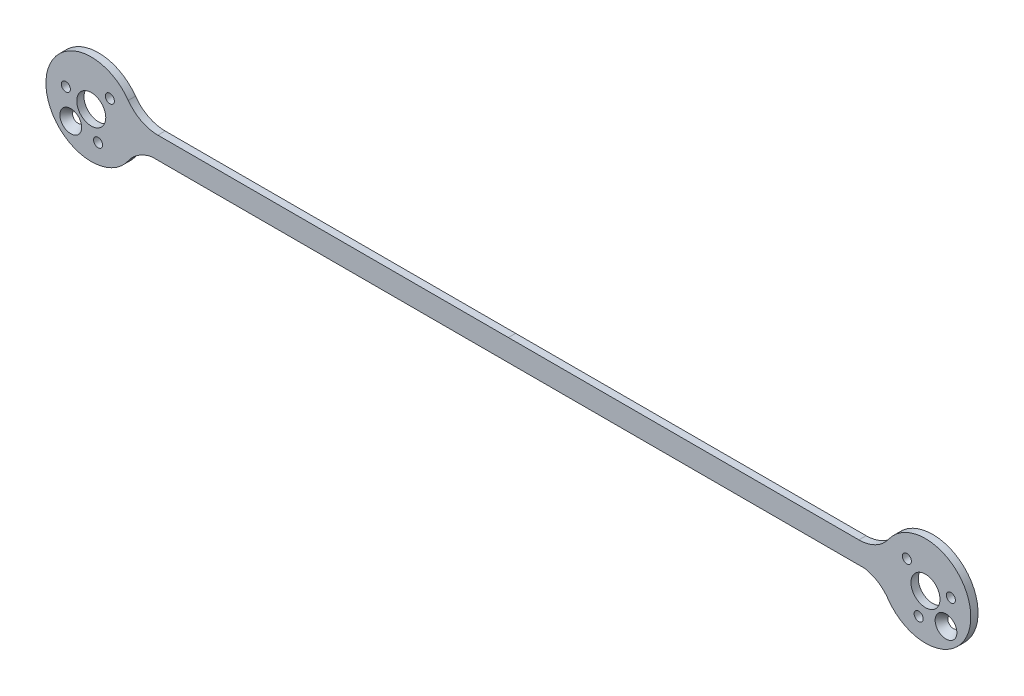
from build123d import *
from OCP.BRepFilletAPI import BRepFilletAPI_MakeChamfer

# Parameters (mm, degrees)
SKETCH_1_R       = 3
SKETCH_1_R_2     = 4
SKETCH_1_R_3     = 1.25
SKETCH_1_R_4     = 1.5
EXTRUDE_1_DEPTH  = 2
CHAMFER_1_SIZE   = 1.5
CHAMFER_1_SIZE_2 = 2


with BuildPart() as part:
    # 草图1 → 凸台-拉伸1 (new body)
    # profile 1 of 3: a face of its own
    with BuildSketch(Plane.XY):
        with BuildLine():
            ThreePointArc((-105.718905787, 7.244728588), (-102.151651286, 4.140596435), (-97.556989056, 3.022553461))
            Line((-97.556989056, 3.022553461), (-0.921282848, 3.022639283))
            Line((-0.921282848, 3.022639283), (95.714423361, 3.022750547))
            ThreePointArc((95.714423361, 3.022750547), (100.30908331, 4.140802892), (103.87633148, 7.24494232))
            ThreePointArc((103.87633148, 7.24494232), (126.57834594, -0.028036342), (103.817957269, -7.116222762))
            ThreePointArc((103.817957269, -7.116222762), (100.989655875, -4.398243929), (97.333501186, -2.977247589))
            Line((97.333501186, -2.977247589), (-0.921276729, -2.977360717))
            Line((-0.921276729, -2.977360717), (-99.176054645, -2.977447977))
            ThreePointArc((-99.176054645, -2.977447977), (-102.832206436, -4.398451774), (-105.660502287, -7.116436375))
            ThreePointArc((-105.660502287, -7.116436375), (-128.420905414, -0.028296374), (-105.718905787, 7.244728588))
        make_face()
        with Locations((-121.57813209, -5.634211545)):
            Circle(SKETCH_1_R, mode=Mode.SUBTRACT)
        with Locations((-115.921163949, 0.022537151)):
            Circle(SKETCH_1_R_2, mode=Mode.SUBTRACT)
        with Locations((119.735576409, -5.634211545)):
            Circle(SKETCH_1_R, mode=Mode.SUBTRACT)
        with Locations((112.202284082, -6.980319536)):
            Circle(SKETCH_1_R_3, mode=Mode.SUBTRACT)
        with Locations((114.078604371, 0.022771691)):
            Circle(SKETCH_1_R_2, mode=Mode.SUBTRACT)
        with Locations((-110.794753677, 5.149166868)):
            Circle(SKETCH_1_R_3, mode=Mode.SUBTRACT)
        with Locations((-122.924240081, 1.899080781)):
            Circle(SKETCH_1_R_3, mode=Mode.SUBTRACT)
        with Locations((121.0816844, 1.899080781)):
            Circle(SKETCH_1_R_3, mode=Mode.SUBTRACT)
        with Locations((-114.044839764, -6.980319536)):
            Circle(SKETCH_1_R_3, mode=Mode.SUBTRACT)
        with Locations((108.952197996, 5.149166868)):
            Circle(SKETCH_1_R_3, mode=Mode.SUBTRACT)
    # profile 2 of 3: a face of its own
    with BuildSketch(Plane.XY):
        with Locations((-121.57813209, -5.634211545)):
            Circle(SKETCH_1_R)
        with Locations((-121.57813209, -5.634211545)):
            Circle(SKETCH_1_R_4, mode=Mode.SUBTRACT)
    # profile 3 of 3: a face of its own
    with BuildSketch(Plane.XY):
        with Locations((119.735576409, -5.634211545)):
            Circle(SKETCH_1_R)
        with Locations((119.735576409, -5.634211545)):
            Circle(SKETCH_1_R_4, mode=Mode.SUBTRACT)
    extrude(amount=EXTRUDE_1_DEPTH)

    # 倒角1
    chamfer_1_edges_1 = [part.edges().sort_by_distance(p)[0] for p in [
        (118.235576409, -5.634211545, 2),
    ]]
    chamfer_1_side_1 = [part.faces().sort_by_distance(p)[0] for p in [
        (118.205576409, -5.634211545, 2),
    ]]
    chamfer_1_edges_2 = [part.edges().sort_by_distance(p)[0] for p in [
        (-123.07813209, -5.634211545, 2),
    ]]
    chamfer_1_side_2 = [part.faces().sort_by_distance(p)[0] for p in [
        (-123.10813209, -5.634211545, 2),
    ]]
    chamfer_1 = BRepFilletAPI_MakeChamfer(part.part.solid().wrapped)
    for e in chamfer_1_edges_1:
        chamfer_1.Add(CHAMFER_1_SIZE - 0.0001, CHAMFER_1_SIZE_2 - 0.0001, e.wrapped, chamfer_1_side_1[0].wrapped)
    for e in chamfer_1_edges_2:
        chamfer_1.Add(CHAMFER_1_SIZE - 0.0001, CHAMFER_1_SIZE_2 - 0.0001, e.wrapped, chamfer_1_side_2[0].wrapped)
    add(Compound.cast(chamfer_1.Shape()), mode=Mode.REPLACE)  # a hair under: the kernel refuses the full size


solid = part.part
